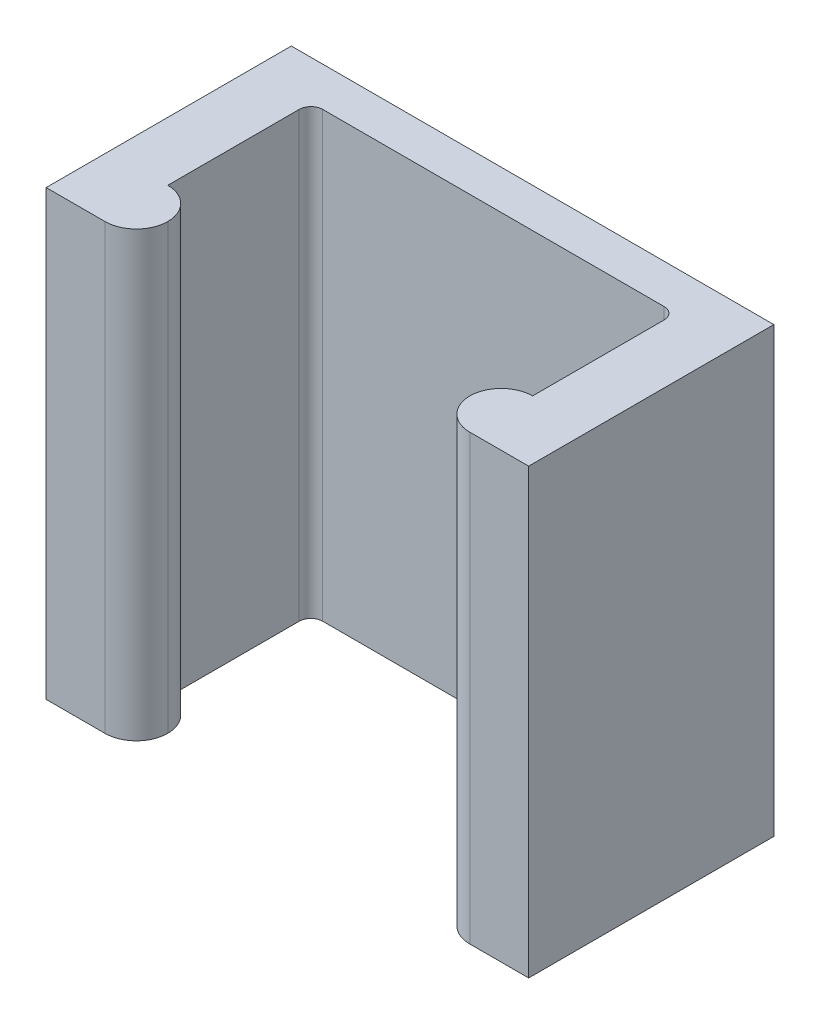
from build123d import *

# Parameters (mm, degrees)
SKETCH_1_W          = 12.3
SKETCH_1_H          = 11.3
EXTRUDE_1_DEPTH     = 2
SKETCH_2_W          = 1.5
SKETCH_2_H          = 11.3
EXTRUDE_2_DEPTH     = 4.25
SKETCH_5_W          = 9.3
SKETCH_5_H          = 11.5
CUT_EXTRUDE_1_DEPTH = 1
SKETCH_8_W          = 1.6
SKETCH_8_H          = 11.3
EXTRUDE_5_DEPTH     = 0.8
SKETCH_9_W          = 1.6
SKETCH_9_H          = 11.3
EXTRUDE_6_DEPTH     = 0.8
FILLET_7_R          = 0.8
FILLET_8_R          = 0.3


with BuildPart() as part:
    # 스케치1 → 보스-돌출1 (new body)
    with BuildSketch(Plane.XY):
        Rectangle(SKETCH_1_W, SKETCH_1_H)
    extrude(amount=EXTRUDE_1_DEPTH)

    # 스케치2 → 보스-돌출2 (add)
    with BuildSketch(Plane.XY.offset(2)):
        with Locations((-5.4, 0)):
            Rectangle(SKETCH_2_W, SKETCH_2_H)
        with Locations((5.4, 0)):
            Rectangle(SKETCH_2_W, SKETCH_2_H)
    extrude(amount=EXTRUDE_2_DEPTH)

    # 스케치5 → 컷-돌출1 (cut)
    with BuildSketch(Plane.XY.offset(2)):
        Rectangle(SKETCH_5_W, SKETCH_5_H)
    extrude(amount=-CUT_EXTRUDE_1_DEPTH, mode=Mode.SUBTRACT)

    # 스케치8 → 보스-돌출5 (add)
    with BuildSketch(Plane(origin=(-4.65, 0, 0), x_dir=(0, 0, -1), z_dir=(1, 0, 0))):
        with Locations((-5.45, 0)):
            Rectangle(SKETCH_8_W, SKETCH_8_H)
    extrude(amount=EXTRUDE_5_DEPTH)

    # 스케치9 → 보스-돌출6 (add)
    with BuildSketch(Plane.ZY.offset(-4.65)):
        with Locations((5.45, 0)):
            Rectangle(SKETCH_9_W, SKETCH_9_H)
    extrude(amount=EXTRUDE_6_DEPTH)

    # 필렛7
    fillet_7_edges = [part.edges().sort_by_distance(p)[0] for p in [
        (3.85, 0, 6.25),
        (-3.85, 0, 6.25),
        (3.85, 0, 4.65),
        (-3.85, 0, 4.65),
    ]]
    fillet(fillet_7_edges, radius=FILLET_7_R - 0.0001)  # a hair under: the kernel refuses the full size

    # 필렛8
    fillet_8_edges = [part.edges().sort_by_distance(p)[0] for p in [
        (4.65, 0, 1),
        (-4.65, 0, 1),
    ]]
    fillet(fillet_8_edges, radius=FILLET_8_R)


solid = part.part
